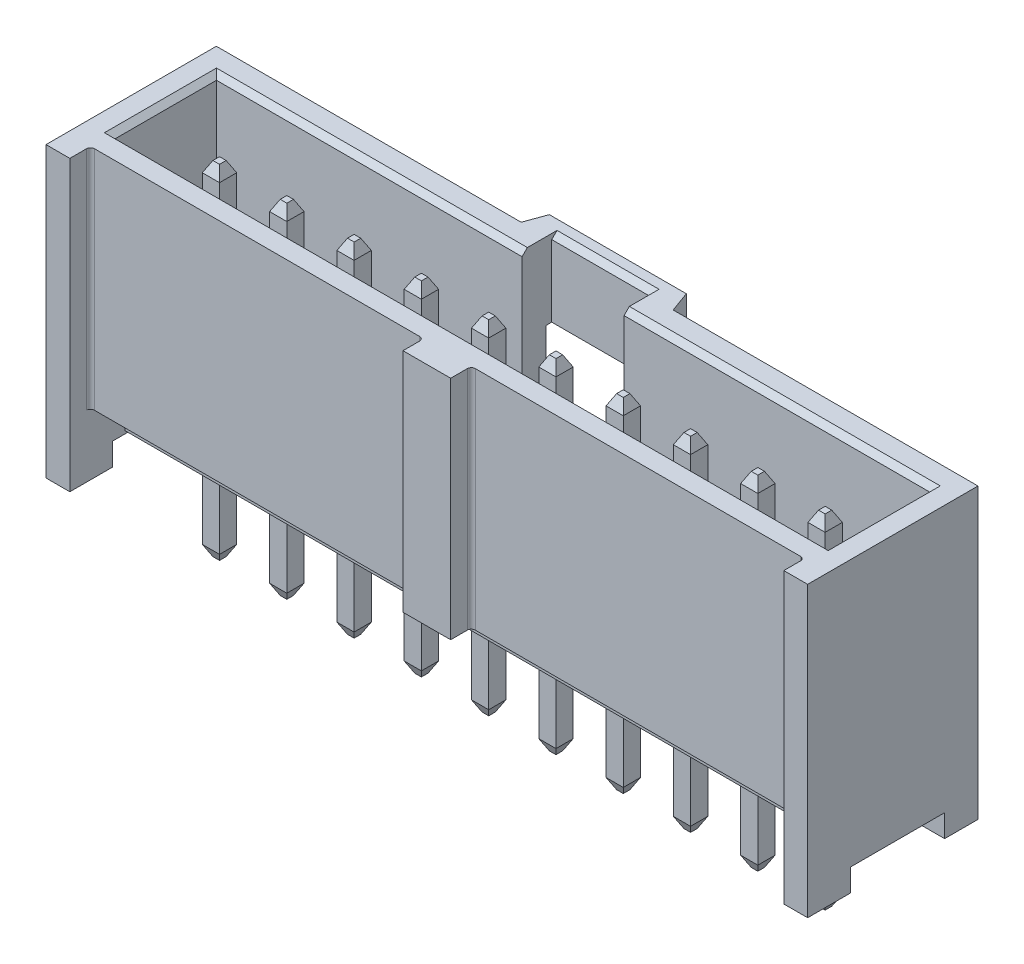
from build123d import *
from OCP.BRepFilletAPI import BRepFilletAPI_MakeChamfer

# Parameters (mm, degrees)
CUT_EXTRUDE1_START       = -16.3
CUT_EXTRUDE1_OUTLINE_W   = 10.05
CUT_EXTRUDE1_OUTLINE_H   = 5.52
CUT_EXTRUDE1_DEPTH       = 28.75
CUT_EXTRUDE1_2_OUTLINE_W = 10.05
CUT_EXTRUDE1_2_OUTLINE_H = 1.12
CUT_EXTRUDE1_2_DEPTH     = 12.45
CUT_EXTRUDE1_3_OUTLINE_W = 10.05
CUT_EXTRUDE1_3_OUTLINE_H = 1.12
CUT_EXTRUDE1_3_DEPTH     = 12.45
SKETCH2_W                = 0.21
SKETCH2_H                = 10.05
CUT_EXTRUDE2_DEPTH       = 11.7896
SKETCH3_W                = 12.45
SKETCH3_H                = 0.21
SKETCH3_W_2              = 0.6604
CUT_EXTRUDE3_DEPTH       = 7.15
SKETCH4_W                = 0.21
SKETCH4_H                = 2.9
CUT_EXTRUDE4_DEPTH       = 11.7896
CUT_EXTRUDE5_DEPTH       = 7.1
SKETCH6_W                = 5.1708
SKETCH6_H                = 2.9
BOSS_EXTRUDE1_DEPTH      = 0.57
SKETCH7_W                = 26.95
SKETCH7_H                = 0.78
CUT_EXTRUDE6_DEPTH       = 18.906399694
SKETCH8_W                = 1.8
SKETCH8_H                = 8.55
BOSS_EXTRUDE2_DEPTH      = 0.78
SKETCH9_W                = 26.95
SKETCH9_H                = 1.5
CUT_EXTRUDE7_DEPTH       = 1.31
SKETCH10_W               = 0.9
SKETCH10_H               = 1.61
BOSS_EXTRUDE3_DEPTH      = 0.85
SKETCH11_W               = 0.9
SKETCH11_H               = 1.61
BOSS_EXTRUDE4_DEPTH      = 0.85
CUT_EXTRUDE8_REACH       = 18.073
SKETCH13_W               = 3.85
SKETCH13_H               = 1.5
SKETCH14_W               = 1.74
SKETCH14_H               = 1.5
CUT_EXTRUDE9_DEPTH       = 11.55
SKETCH15_W               = 0.9
SKETCH15_H               = 1.26
BOSS_EXTRUDE5_DEPTH      = 0.85
SKETCH16_W               = 1.74
SKETCH16_H               = 1.5
CUT_EXTRUDE10_DEPTH      = 11.55
SKETCH17_W               = 0.9
SKETCH17_H               = 1.26
BOSS_EXTRUDE6_DEPTH      = 0.85
SKETCH18_W               = 26.92
SKETCH18_H               = 3
CUT_EXTRUDE11_DEPTH      = 0.5
CUT_EXTRUDE12_REACH      = 18.433
SKETCH20_W               = 26.92
SKETCH20_H               = 0.415
SKETCH21_W               = 0.65
SKETCH21_H               = 0.65
BOSS_EXTRUDE7_DEPTH      = 3.75
SKETCH22_W               = 0.65
SKETCH22_H               = 0.65
BOSS_EXTRUDE8_DEPTH      = 3.75
SKETCH23_W               = 0.65
SKETCH23_H               = 0.65
BOSS_EXTRUDE9_DEPTH      = 3.75
SKETCH24_W               = 0.65
SKETCH24_H               = 0.65
BOSS_EXTRUDE10_DEPTH     = 3.75
SKETCH25_W               = 0.65
SKETCH25_H               = 0.65
BOSS_EXTRUDE11_DEPTH     = 3.75
SKETCH26_W               = 0.65
SKETCH26_H               = 0.65
BOSS_EXTRUDE12_DEPTH     = 3.75
SKETCH27_W               = 0.65
SKETCH27_H               = 0.65
BOSS_EXTRUDE13_DEPTH     = 3.75
SKETCH28_W               = 0.65
SKETCH28_H               = 0.65
BOSS_EXTRUDE14_DEPTH     = 3.75
SKETCH29_W               = 0.65
SKETCH29_H               = 0.65
BOSS_EXTRUDE15_DEPTH     = 3.75
SKETCH30_W               = 0.65
SKETCH30_H               = 0.65
BOSS_EXTRUDE16_DEPTH     = 3.75
SKETCH31_W               = 0.65
SKETCH31_H               = 0.65
BOSS_EXTRUDE17_DEPTH     = 6.75
SKETCH32_W               = 0.65
SKETCH32_H               = 0.65
BOSS_EXTRUDE18_DEPTH     = 6.75
SKETCH33_W               = 0.65
SKETCH33_H               = 0.65
BOSS_EXTRUDE19_DEPTH     = 6.75
SKETCH34_W               = 0.65
SKETCH34_H               = 0.65
BOSS_EXTRUDE20_DEPTH     = 6.75
SKETCH35_W               = 0.65
SKETCH35_H               = 0.65
BOSS_EXTRUDE21_DEPTH     = 6.75
SKETCH36_W               = 0.65
SKETCH36_H               = 0.65
BOSS_EXTRUDE22_DEPTH     = 6.75
SKETCH37_W               = 0.65
SKETCH37_H               = 0.65
BOSS_EXTRUDE23_DEPTH     = 6.75
SKETCH38_W               = 0.65
SKETCH38_H               = 0.65
BOSS_EXTRUDE24_DEPTH     = 6.75
SKETCH39_W               = 0.65
SKETCH39_H               = 0.65
BOSS_EXTRUDE25_DEPTH     = 6.75
SKETCH40_W               = 0.65
SKETCH40_H               = 0.65
BOSS_EXTRUDE26_DEPTH     = 6.75
DRAFT1_ANGLE             = 20
CHAMFER1_SIZE            = 0.2
CHAMFER2_SIZE            = 0.1
CHAMFER3_SIZE            = 0.2
CHAMFER3_SIZE2           = 0.4
FILLET1_R                = 0.15


with BuildPart() as part:
    # Cut-Extrude1: read off the stored shape, not the designer's step
    # Cut-Extrude1 outline → Cut-Extrude1 (new body)
    with BuildSketch(Plane(origin=(-1.925, 0, 0), x_dir=(0, -1, 0), z_dir=(-1, 0, 0)).offset(CUT_EXTRUDE1_START)):
        with Locations((-0.425, 0.845)):
            Rectangle(CUT_EXTRUDE1_OUTLINE_W, CUT_EXTRUDE1_OUTLINE_H)
    extrude(amount=CUT_EXTRUDE1_DEPTH)

    # Cut-Extrude1 2 outline → Cut-Extrude1 2 (add)
    with BuildSketch(Plane(origin=(-1.925, 0, 0), x_dir=(0, -1, 0), z_dir=(-1, 0, 0)).offset(CUT_EXTRUDE1_START)):
        with Locations((-0.425, -2.475)):
            Rectangle(CUT_EXTRUDE1_2_OUTLINE_W, CUT_EXTRUDE1_2_OUTLINE_H)
    extrude(amount=CUT_EXTRUDE1_2_DEPTH)

    # Cut-Extrude1 3 outline → Cut-Extrude1 3 (add)
    with BuildSketch(Plane(origin=(-1.925, 0, 0), x_dir=(0, -1, 0), z_dir=(-1, 0, 0))):
        with Locations((-0.425, -2.475)):
            Rectangle(CUT_EXTRUDE1_3_OUTLINE_W, CUT_EXTRUDE1_3_OUTLINE_H)
    extrude(amount=CUT_EXTRUDE1_3_DEPTH)

    # Sketch2 → Cut-Extrude2 (cut)
    with BuildSketch(Plane(origin=(14.375, 0, 0), x_dir=(0, 0, -1), z_dir=(1, 0, 0))):
        with Locations((2.93, 0.425)):
            Rectangle(SKETCH2_W, SKETCH2_H)
    extrude(amount=-CUT_EXTRUDE2_DEPTH, mode=Mode.SUBTRACT)

    # Sketch3 → Cut-Extrude3 (cut)
    with BuildSketch(Plane.XZ.offset(4.6)):
        with Locations((-8.15, -2.93)):
            Rectangle(SKETCH3_W, SKETCH3_H)
        with Locations((2.2552, -2.93)):
            Rectangle(SKETCH3_W_2, SKETCH3_H)
    extrude(amount=-CUT_EXTRUDE3_DEPTH, mode=Mode.SUBTRACT)

    # Sketch4 → Cut-Extrude4 (cut)
    with BuildSketch(Plane.ZY.offset(14.375)):
        with Locations((-2.93, 4)):
            Rectangle(SKETCH4_W, SKETCH4_H)
    extrude(amount=-CUT_EXTRUDE4_DEPTH, mode=Mode.SUBTRACT)

    # Sketch5 → Cut-Extrude5 (cut)
    with BuildSketch(Plane(origin=(0, 5.45, 0), x_dir=(-1, 0, 0), z_dir=(0, 1, 0))):
        Polygon((-13.46, -1.915), (-1.925, -1.915), (1.925, -1.915), (13.46, -1.915), (13.46, 1.5), (-13.46, 1.5), align=None)
    extrude(amount=-CUT_EXTRUDE5_DEPTH, mode=Mode.SUBTRACT)

    # Sketch6 → Boss-Extrude1 (add)
    with BuildSketch(Plane(origin=(0, 0, -3.035), x_dir=(-1, 0, 0), z_dir=(0, 0, -1))):
        with Locations((0, 4)):
            Rectangle(SKETCH6_W, SKETCH6_H)
    extrude(amount=BOSS_EXTRUDE1_DEPTH)

    # Sketch7 → Cut-Extrude6 (cut, through all)
    with BuildSketch(Plane.XZ.offset(4.6)):
        with Locations((0, 3.215)):
            Rectangle(SKETCH7_W, SKETCH7_H)
    extrude(amount=-CUT_EXTRUDE6_DEPTH, mode=Mode.SUBTRACT)

    # Sketch8 → Boss-Extrude2 (add)
    with BuildSketch(Plane.XY.offset(2.825)):
        with Locations((0, 1.175)):
            Rectangle(SKETCH8_W, SKETCH8_H)
    extrude(amount=BOSS_EXTRUDE2_DEPTH)

    # Sketch9 → Cut-Extrude7 (cut)
    with BuildSketch(Plane.XY.offset(2.825)):
        with Locations((0, -3.85)):
            Rectangle(SKETCH9_W, SKETCH9_H)
    extrude(amount=-CUT_EXTRUDE7_DEPTH, mode=Mode.SUBTRACT)

    # Sketch10 → Boss-Extrude3 (add)
    with BuildSketch(Plane.XZ.offset(4.6)):
        with Locations((-13.925, 2.8)):
            Rectangle(SKETCH10_W, SKETCH10_H)
    extrude(amount=BOSS_EXTRUDE3_DEPTH)

    # Sketch11 → Boss-Extrude4 (add)
    with BuildSketch(Plane.XZ.offset(4.6)):
        with Locations((13.925, 2.8)):
            Rectangle(SKETCH11_W, SKETCH11_H)
    extrude(amount=BOSS_EXTRUDE4_DEPTH)

    # Sketch13 → Cut-Extrude8 (cut, up to next)
    with BuildSketch(Plane.XY.offset(-1.085), mode=Mode.PRIVATE) as cut_extrude8_sk1:
        with Locations((0, -3.85)):
            Rectangle(SKETCH13_W, SKETCH13_H)
    cut_extrude8_tool1 = extrude(cut_extrude8_sk1.sketch, amount=-CUT_EXTRUDE8_REACH, mode=Mode.PRIVATE) & part.part
    add(cut_extrude8_tool1.solids().sort_by_distance((0, -3.85, -1.085))[0], mode=Mode.SUBTRACT)

    # Sketch14 → Cut-Extrude9 (cut)
    with BuildSketch(Plane.ZY.offset(-1.925)):
        with Locations((-1.955, -3.85)):
            Rectangle(SKETCH14_W, SKETCH14_H)
    extrude(amount=-CUT_EXTRUDE9_DEPTH, mode=Mode.SUBTRACT)

    # Sketch15 → Boss-Extrude5 (add)
    with BuildSketch(Plane.XZ.offset(4.6)):
        with Locations((13.925, -2.195)):
            Rectangle(SKETCH15_W, SKETCH15_H)
    extrude(amount=BOSS_EXTRUDE5_DEPTH)

    # Sketch16 → Cut-Extrude10 (cut)
    with BuildSketch(Plane(origin=(-1.925, 0, 0), x_dir=(0, 0, -1), z_dir=(1, 0, 0))):
        with Locations((1.955, -3.85)):
            Rectangle(SKETCH16_W, SKETCH16_H)
    extrude(amount=-CUT_EXTRUDE10_DEPTH, mode=Mode.SUBTRACT)

    # Sketch17 → Boss-Extrude6 (add)
    with BuildSketch(Plane.XZ.offset(4.6)):
        with Locations((-13.925, -2.195)):
            Rectangle(SKETCH17_W, SKETCH17_H)
    extrude(amount=BOSS_EXTRUDE6_DEPTH)

    # Sketch18 → Cut-Extrude11 (cut)
    with BuildSketch(Plane(origin=(0, -1.65, 0), x_dir=(-1, 0, 0), z_dir=(0, 1, 0))):
        Rectangle(SKETCH18_W, SKETCH18_H)
    extrude(amount=-CUT_EXTRUDE11_DEPTH, mode=Mode.SUBTRACT)

    # Sketch20 → Cut-Extrude12 (cut, up to next)
    with BuildSketch(Plane.XZ.offset(1.65), mode=Mode.PRIVATE) as cut_extrude12_sk1:
        with Locations((0, 1.7075)):
            Rectangle(SKETCH20_W, SKETCH20_H)
    cut_extrude12_tool1 = extrude(cut_extrude12_sk1.sketch, amount=-CUT_EXTRUDE12_REACH, mode=Mode.PRIVATE) & part.part
    add(cut_extrude12_tool1.solids().sort_by_distance((0, -1.65, 1.7075))[0], mode=Mode.SUBTRACT)

    # Sketch21 → Boss-Extrude7 (add)
    with BuildSketch(Plane.XZ.offset(4.6)):
        with Locations((-11.43, 0)):
            Rectangle(SKETCH21_W, SKETCH21_H)
    extrude(amount=BOSS_EXTRUDE7_DEPTH)

    # Sketch22 → Boss-Extrude8 (add)
    with BuildSketch(Plane.XZ.offset(4.6)):
        with Locations((-8.89, 0)):
            Rectangle(SKETCH22_W, SKETCH22_H)
    extrude(amount=BOSS_EXTRUDE8_DEPTH)

    # Sketch23 → Boss-Extrude9 (add)
    with BuildSketch(Plane.XZ.offset(4.6)):
        with Locations((-6.35, 0)):
            Rectangle(SKETCH23_W, SKETCH23_H)
    extrude(amount=BOSS_EXTRUDE9_DEPTH)

    # Sketch24 → Boss-Extrude10 (add)
    with BuildSketch(Plane.XZ.offset(4.6)):
        with Locations((-3.81, 0)):
            Rectangle(SKETCH24_W, SKETCH24_H)
    extrude(amount=BOSS_EXTRUDE10_DEPTH)

    # Sketch25 → Boss-Extrude11 (add)
    with BuildSketch(Plane.XZ.offset(4.6)):
        with Locations((-1.27, 0)):
            Rectangle(SKETCH25_W, SKETCH25_H)
    extrude(amount=BOSS_EXTRUDE11_DEPTH)

    # Sketch26 → Boss-Extrude12 (add)
    with BuildSketch(Plane.XZ.offset(4.6)):
        with Locations((1.27, 0)):
            Rectangle(SKETCH26_W, SKETCH26_H)
    extrude(amount=BOSS_EXTRUDE12_DEPTH)

    # Sketch27 → Boss-Extrude13 (add)
    with BuildSketch(Plane.XZ.offset(4.6)):
        with Locations((3.81, 0)):
            Rectangle(SKETCH27_W, SKETCH27_H)
    extrude(amount=BOSS_EXTRUDE13_DEPTH)

    # Sketch28 → Boss-Extrude14 (add)
    with BuildSketch(Plane.XZ.offset(4.6)):
        with Locations((6.35, 0)):
            Rectangle(SKETCH28_W, SKETCH28_H)
    extrude(amount=BOSS_EXTRUDE14_DEPTH)

    # Sketch29 → Boss-Extrude15 (add)
    with BuildSketch(Plane.XZ.offset(4.6)):
        with Locations((8.89, 0)):
            Rectangle(SKETCH29_W, SKETCH29_H)
    extrude(amount=BOSS_EXTRUDE15_DEPTH)

    # Sketch30 → Boss-Extrude16 (add)
    with BuildSketch(Plane.XZ.offset(4.6)):
        with Locations((11.43, 0)):
            Rectangle(SKETCH30_W, SKETCH30_H)
    extrude(amount=BOSS_EXTRUDE16_DEPTH)

    # Sketch31 → Boss-Extrude17 (add)
    with BuildSketch(Plane(origin=(0, -2.15, 0), x_dir=(-1, 0, 0), z_dir=(0, 1, 0))):
        with Locations((11.43, 0)):
            Rectangle(SKETCH31_W, SKETCH31_H)
    extrude(amount=BOSS_EXTRUDE17_DEPTH)

    # Sketch32 → Boss-Extrude18 (add)
    with BuildSketch(Plane(origin=(0, -2.15, 0), x_dir=(-1, 0, 0), z_dir=(0, 1, 0))):
        with Locations((8.89, 0)):
            Rectangle(SKETCH32_W, SKETCH32_H)
    extrude(amount=BOSS_EXTRUDE18_DEPTH)

    # Sketch33 → Boss-Extrude19 (add)
    with BuildSketch(Plane(origin=(0, -2.15, 0), x_dir=(-1, 0, 0), z_dir=(0, 1, 0))):
        with Locations((6.35, 0)):
            Rectangle(SKETCH33_W, SKETCH33_H)
    extrude(amount=BOSS_EXTRUDE19_DEPTH)

    # Sketch34 → Boss-Extrude20 (add)
    with BuildSketch(Plane(origin=(0, -2.15, 0), x_dir=(-1, 0, 0), z_dir=(0, 1, 0))):
        with Locations((3.81, 0)):
            Rectangle(SKETCH34_W, SKETCH34_H)
    extrude(amount=BOSS_EXTRUDE20_DEPTH)

    # Sketch35 → Boss-Extrude21 (add)
    with BuildSketch(Plane(origin=(0, -2.15, 0), x_dir=(-1, 0, 0), z_dir=(0, 1, 0))):
        with Locations((1.27, 0)):
            Rectangle(SKETCH35_W, SKETCH35_H)
    extrude(amount=BOSS_EXTRUDE21_DEPTH)

    # Sketch36 → Boss-Extrude22 (add)
    with BuildSketch(Plane(origin=(0, -2.15, 0), x_dir=(-1, 0, 0), z_dir=(0, 1, 0))):
        with Locations((-1.27, 0)):
            Rectangle(SKETCH36_W, SKETCH36_H)
    extrude(amount=BOSS_EXTRUDE22_DEPTH)

    # Sketch37 → Boss-Extrude23 (add)
    with BuildSketch(Plane(origin=(0, -2.15, 0), x_dir=(-1, 0, 0), z_dir=(0, 1, 0))):
        with Locations((-3.81, 0)):
            Rectangle(SKETCH37_W, SKETCH37_H)
    extrude(amount=BOSS_EXTRUDE23_DEPTH)

    # Sketch38 → Boss-Extrude24 (add)
    with BuildSketch(Plane(origin=(0, -2.15, 0), x_dir=(-1, 0, 0), z_dir=(0, 1, 0))):
        with Locations((-6.35, 0)):
            Rectangle(SKETCH38_W, SKETCH38_H)
    extrude(amount=BOSS_EXTRUDE24_DEPTH)

    # Sketch39 → Boss-Extrude25 (add)
    with BuildSketch(Plane(origin=(0, -2.15, 0), x_dir=(-1, 0, 0), z_dir=(0, 1, 0))):
        with Locations((-8.89, 0)):
            Rectangle(SKETCH39_W, SKETCH39_H)
    extrude(amount=BOSS_EXTRUDE25_DEPTH)

    # Sketch40 → Boss-Extrude26 (add)
    with BuildSketch(Plane(origin=(0, -2.15, 0), x_dir=(-1, 0, 0), z_dir=(0, 1, 0))):
        with Locations((-11.43, 0)):
            Rectangle(SKETCH40_W, SKETCH40_H)
    extrude(amount=BOSS_EXTRUDE26_DEPTH)

    # Draft1
    draft1_faces = [part.faces().sort_by_distance(p)[0] for p in [
        (-2.5854, 4, -3.215),
        (2.5854, 4, -3.215),
    ]]
    draft(draft1_faces, Plane(origin=(0, 0, -3.605), x_dir=(-1, 0, 0), z_dir=(0, 0, -1)), DRAFT1_ANGLE)

    # Chamfer1
    chamfer1_edges = [part.edges().sort_by_distance(p)[0] for p in [
        (13.46, 5.45, 0),
        (7.6925, 5.45, -1.915),
        (-7.6925, 5.45, -1.915),
        (-13.46, 5.45, 0),
        (0, 5.45, -3.035),
        (0, 5.45, 1.915),
    ]]
    chamfer(chamfer1_edges, length=CHAMFER1_SIZE)

    # Chamfer2
    chamfer2_edges = [part.edges().sort_by_distance(p)[0] for p in [
        (0, -4.6, 1.515),
        (0, -4.6, -1.085),
    ]]
    chamfer(chamfer2_edges, length=CHAMFER2_SIZE)

    # Chamfer3: one chamfer whose edges measure the first distance from different faces: ONE call of the kernel's chamfer builder (chamfer() names one face for all edges)
    chamfer3_edges_1 = [part.edges().sort_by_distance(p)[0] for p in [
        (-11.755, -8.35, 0),
        (-11.43, -8.35, -0.325),
        (-11.105, -8.35, 0),
        (-11.43, -8.35, 0.325),
    ]]
    chamfer3_side_1 = [part.faces().sort_by_distance(p)[0] for p in [
        (-11.43, -8.35, 0),
    ]]
    chamfer3_edges_2 = [part.edges().sort_by_distance(p)[0] for p in [
        (-9.215, -8.35, 0),
        (-8.89, -8.35, -0.325),
        (-8.565, -8.35, 0),
        (-8.89, -8.35, 0.325),
    ]]
    chamfer3_side_2 = [part.faces().sort_by_distance(p)[0] for p in [
        (-8.89, -8.35, 0),
    ]]
    chamfer3_edges_3 = [part.edges().sort_by_distance(p)[0] for p in [
        (-6.675, -8.35, 0),
        (-6.35, -8.35, -0.325),
        (-6.025, -8.35, 0),
        (-6.35, -8.35, 0.325),
    ]]
    chamfer3_side_3 = [part.faces().sort_by_distance(p)[0] for p in [
        (-6.35, -8.35, 0),
    ]]
    chamfer3_edges_4 = [part.edges().sort_by_distance(p)[0] for p in [
        (-4.135, -8.35, 0),
        (-3.81, -8.35, -0.325),
        (-3.485, -8.35, 0),
        (-3.81, -8.35, 0.325),
    ]]
    chamfer3_side_4 = [part.faces().sort_by_distance(p)[0] for p in [
        (-3.81, -8.35, 0),
    ]]
    chamfer3_edges_5 = [part.edges().sort_by_distance(p)[0] for p in [
        (-1.595, -8.35, 0),
        (-1.27, -8.35, -0.325),
        (-0.945, -8.35, 0),
        (-1.27, -8.35, 0.325),
    ]]
    chamfer3_side_5 = [part.faces().sort_by_distance(p)[0] for p in [
        (-1.27, -8.35, 0),
    ]]
    chamfer3_edges_6 = [part.edges().sort_by_distance(p)[0] for p in [
        (1.27, -8.35, -0.325),
        (1.595, -8.35, 0),
        (1.27, -8.35, 0.325),
        (0.945, -8.35, 0),
    ]]
    chamfer3_side_6 = [part.faces().sort_by_distance(p)[0] for p in [
        (1.27, -8.35, 0),
    ]]
    chamfer3_edges_7 = [part.edges().sort_by_distance(p)[0] for p in [
        (3.81, -8.35, -0.325),
        (4.135, -8.35, 0),
        (3.81, -8.35, 0.325),
        (3.485, -8.35, 0),
    ]]
    chamfer3_side_7 = [part.faces().sort_by_distance(p)[0] for p in [
        (3.81, -8.35, 0),
    ]]
    chamfer3_edges_8 = [part.edges().sort_by_distance(p)[0] for p in [
        (6.35, -8.35, -0.325),
        (6.675, -8.35, 0),
        (6.35, -8.35, 0.325),
        (6.025, -8.35, 0),
    ]]
    chamfer3_side_8 = [part.faces().sort_by_distance(p)[0] for p in [
        (6.35, -8.35, 0),
    ]]
    chamfer3_edges_9 = [part.edges().sort_by_distance(p)[0] for p in [
        (8.89, -8.35, -0.325),
        (9.215, -8.35, 0),
        (8.89, -8.35, 0.325),
        (8.565, -8.35, 0),
    ]]
    chamfer3_side_9 = [part.faces().sort_by_distance(p)[0] for p in [
        (8.89, -8.35, 0),
    ]]
    chamfer3_edges_10 = [part.edges().sort_by_distance(p)[0] for p in [
        (11.43, -8.35, -0.325),
        (11.755, -8.35, 0),
        (11.43, -8.35, 0.325),
        (11.105, -8.35, 0),
    ]]
    chamfer3_side_10 = [part.faces().sort_by_distance(p)[0] for p in [
        (11.43, -8.35, 0),
    ]]
    chamfer3_edges_11 = [part.edges().sort_by_distance(p)[0] for p in [
        (-11.43, 4.6, 0.325),
        (-11.105, 4.6, 0),
        (-11.43, 4.6, -0.325),
        (-11.755, 4.6, 0),
    ]]
    chamfer3_side_11 = [part.faces().sort_by_distance(p)[0] for p in [
        (-11.43, 4.6, 0),
    ]]
    chamfer3_edges_12 = [part.edges().sort_by_distance(p)[0] for p in [
        (-8.89, 4.6, 0.325),
        (-8.565, 4.6, 0),
        (-8.89, 4.6, -0.325),
        (-9.215, 4.6, 0),
    ]]
    chamfer3_side_12 = [part.faces().sort_by_distance(p)[0] for p in [
        (-8.89, 4.6, 0),
    ]]
    chamfer3_edges_13 = [part.edges().sort_by_distance(p)[0] for p in [
        (-6.35, 4.6, 0.325),
        (-6.025, 4.6, 0),
        (-6.35, 4.6, -0.325),
        (-6.675, 4.6, 0),
    ]]
    chamfer3_side_13 = [part.faces().sort_by_distance(p)[0] for p in [
        (-6.35, 4.6, 0),
    ]]
    chamfer3_edges_14 = [part.edges().sort_by_distance(p)[0] for p in [
        (-3.81, 4.6, 0.325),
        (-3.485, 4.6, 0),
        (-3.81, 4.6, -0.325),
        (-4.135, 4.6, 0),
    ]]
    chamfer3_side_14 = [part.faces().sort_by_distance(p)[0] for p in [
        (-3.81, 4.6, 0),
    ]]
    chamfer3_edges_15 = [part.edges().sort_by_distance(p)[0] for p in [
        (-1.27, 4.6, 0.325),
        (-0.945, 4.6, 0),
        (-1.27, 4.6, -0.325),
        (-1.595, 4.6, 0),
    ]]
    chamfer3_side_15 = [part.faces().sort_by_distance(p)[0] for p in [
        (-1.27, 4.6, 0),
    ]]
    chamfer3_edges_16 = [part.edges().sort_by_distance(p)[0] for p in [
        (1.27, 4.6, 0.325),
        (1.595, 4.6, 0),
        (1.27, 4.6, -0.325),
        (0.945, 4.6, 0),
    ]]
    chamfer3_side_16 = [part.faces().sort_by_distance(p)[0] for p in [
        (1.27, 4.6, 0),
    ]]
    chamfer3_edges_17 = [part.edges().sort_by_distance(p)[0] for p in [
        (3.81, 4.6, 0.325),
        (4.135, 4.6, 0),
        (3.81, 4.6, -0.325),
        (3.485, 4.6, 0),
    ]]
    chamfer3_side_17 = [part.faces().sort_by_distance(p)[0] for p in [
        (3.81, 4.6, 0),
    ]]
    chamfer3_edges_18 = [part.edges().sort_by_distance(p)[0] for p in [
        (6.35, 4.6, 0.325),
        (6.675, 4.6, 0),
        (6.35, 4.6, -0.325),
        (6.025, 4.6, 0),
    ]]
    chamfer3_side_18 = [part.faces().sort_by_distance(p)[0] for p in [
        (6.35, 4.6, 0),
    ]]
    chamfer3_edges_19 = [part.edges().sort_by_distance(p)[0] for p in [
        (8.89, 4.6, 0.325),
        (9.215, 4.6, 0),
        (8.89, 4.6, -0.325),
        (8.565, 4.6, 0),
    ]]
    chamfer3_side_19 = [part.faces().sort_by_distance(p)[0] for p in [
        (8.89, 4.6, 0),
    ]]
    chamfer3_edges_20 = [part.edges().sort_by_distance(p)[0] for p in [
        (11.43, 4.6, 0.325),
        (11.755, 4.6, 0),
        (11.43, 4.6, -0.325),
        (11.105, 4.6, 0),
    ]]
    chamfer3_side_20 = [part.faces().sort_by_distance(p)[0] for p in [
        (11.43, 4.6, 0),
    ]]
    chamfer3 = BRepFilletAPI_MakeChamfer(part.part.solid().wrapped)
    for e in chamfer3_edges_1:
        chamfer3.Add(CHAMFER3_SIZE, CHAMFER3_SIZE2, e.wrapped, chamfer3_side_1[0].wrapped)  # the first distance lies on this face
    for e in chamfer3_edges_2:
        chamfer3.Add(CHAMFER3_SIZE, CHAMFER3_SIZE2, e.wrapped, chamfer3_side_2[0].wrapped)  # the first distance lies on this face
    for e in chamfer3_edges_3:
        chamfer3.Add(CHAMFER3_SIZE, CHAMFER3_SIZE2, e.wrapped, chamfer3_side_3[0].wrapped)  # the first distance lies on this face
    for e in chamfer3_edges_4:
        chamfer3.Add(CHAMFER3_SIZE, CHAMFER3_SIZE2, e.wrapped, chamfer3_side_4[0].wrapped)  # the first distance lies on this face
    for e in chamfer3_edges_5:
        chamfer3.Add(CHAMFER3_SIZE, CHAMFER3_SIZE2, e.wrapped, chamfer3_side_5[0].wrapped)  # the first distance lies on this face
    for e in chamfer3_edges_6:
        chamfer3.Add(CHAMFER3_SIZE, CHAMFER3_SIZE2, e.wrapped, chamfer3_side_6[0].wrapped)  # the first distance lies on this face
    for e in chamfer3_edges_7:
        chamfer3.Add(CHAMFER3_SIZE, CHAMFER3_SIZE2, e.wrapped, chamfer3_side_7[0].wrapped)  # the first distance lies on this face
    for e in chamfer3_edges_8:
        chamfer3.Add(CHAMFER3_SIZE, CHAMFER3_SIZE2, e.wrapped, chamfer3_side_8[0].wrapped)  # the first distance lies on this face
    for e in chamfer3_edges_9:
        chamfer3.Add(CHAMFER3_SIZE, CHAMFER3_SIZE2, e.wrapped, chamfer3_side_9[0].wrapped)  # the first distance lies on this face
    for e in chamfer3_edges_10:
        chamfer3.Add(CHAMFER3_SIZE, CHAMFER3_SIZE2, e.wrapped, chamfer3_side_10[0].wrapped)  # the first distance lies on this face
    for e in chamfer3_edges_11:
        chamfer3.Add(CHAMFER3_SIZE, CHAMFER3_SIZE2, e.wrapped, chamfer3_side_11[0].wrapped)  # the first distance lies on this face
    for e in chamfer3_edges_12:
        chamfer3.Add(CHAMFER3_SIZE, CHAMFER3_SIZE2, e.wrapped, chamfer3_side_12[0].wrapped)  # the first distance lies on this face
    for e in chamfer3_edges_13:
        chamfer3.Add(CHAMFER3_SIZE, CHAMFER3_SIZE2, e.wrapped, chamfer3_side_13[0].wrapped)  # the first distance lies on this face
    for e in chamfer3_edges_14:
        chamfer3.Add(CHAMFER3_SIZE, CHAMFER3_SIZE2, e.wrapped, chamfer3_side_14[0].wrapped)  # the first distance lies on this face
    for e in chamfer3_edges_15:
        chamfer3.Add(CHAMFER3_SIZE, CHAMFER3_SIZE2, e.wrapped, chamfer3_side_15[0].wrapped)  # the first distance lies on this face
    for e in chamfer3_edges_16:
        chamfer3.Add(CHAMFER3_SIZE, CHAMFER3_SIZE2, e.wrapped, chamfer3_side_16[0].wrapped)  # the first distance lies on this face
    for e in chamfer3_edges_17:
        chamfer3.Add(CHAMFER3_SIZE, CHAMFER3_SIZE2, e.wrapped, chamfer3_side_17[0].wrapped)  # the first distance lies on this face
    for e in chamfer3_edges_18:
        chamfer3.Add(CHAMFER3_SIZE, CHAMFER3_SIZE2, e.wrapped, chamfer3_side_18[0].wrapped)  # the first distance lies on this face
    for e in chamfer3_edges_19:
        chamfer3.Add(CHAMFER3_SIZE, CHAMFER3_SIZE2, e.wrapped, chamfer3_side_19[0].wrapped)  # the first distance lies on this face
    for e in chamfer3_edges_20:
        chamfer3.Add(CHAMFER3_SIZE, CHAMFER3_SIZE2, e.wrapped, chamfer3_side_20[0].wrapped)  # the first distance lies on this face
    add(Compound.cast(chamfer3.Shape()), mode=Mode.REPLACE)

    # Fillet1
    fillet1_edges = [part.edges().sort_by_distance(p)[0] for p in [
        (13.475, 1.175, 2.825),
        (-13.475, 1.175, 2.825),
        (0.9, 1.175, 2.825),
        (-0.9, 1.175, 2.825),
    ]]
    fillet(fillet1_edges, radius=FILLET1_R)


solid = part.part
